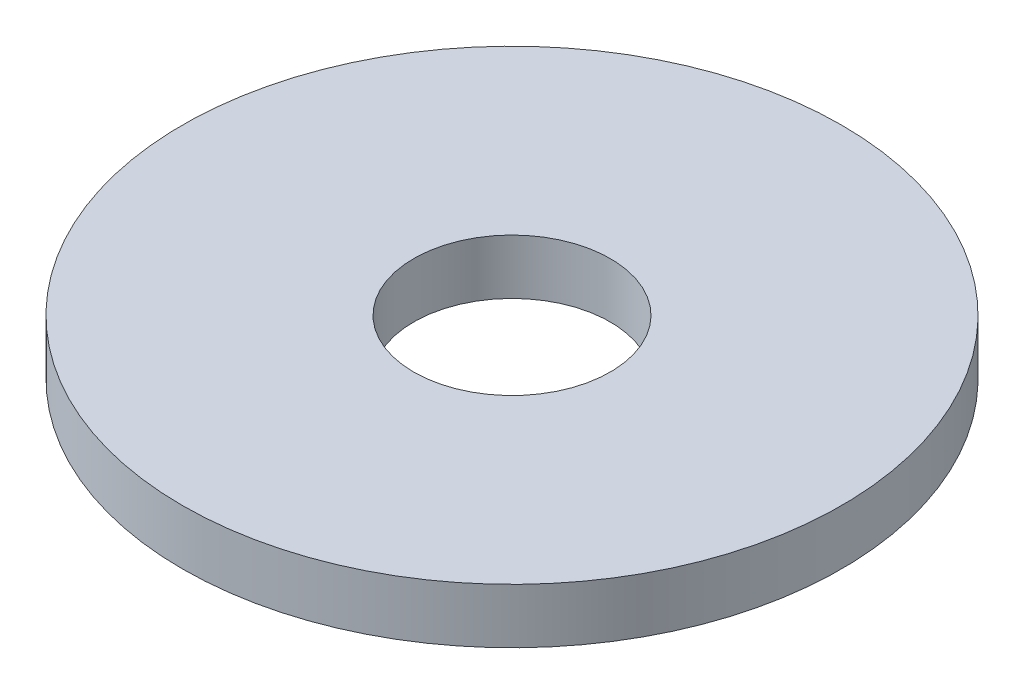
from build123d import *

# Parameters (mm, degrees)
SKETCH1_R           = 38.1
SKETCH1_R_2         = 11.3665
BOSS_EXTRUDE1_DEPTH = 6.35


with BuildPart() as part:
    # Sketch1 → Boss-Extrude1 (new body)
    with BuildSketch(Plane(origin=(0, 0, 0), x_dir=(1, 0, 0), z_dir=(0, 1, 0))):
        Circle(SKETCH1_R)
        Circle(SKETCH1_R_2, mode=Mode.SUBTRACT)
    extrude(amount=BOSS_EXTRUDE1_DEPTH)


solid = part.part
